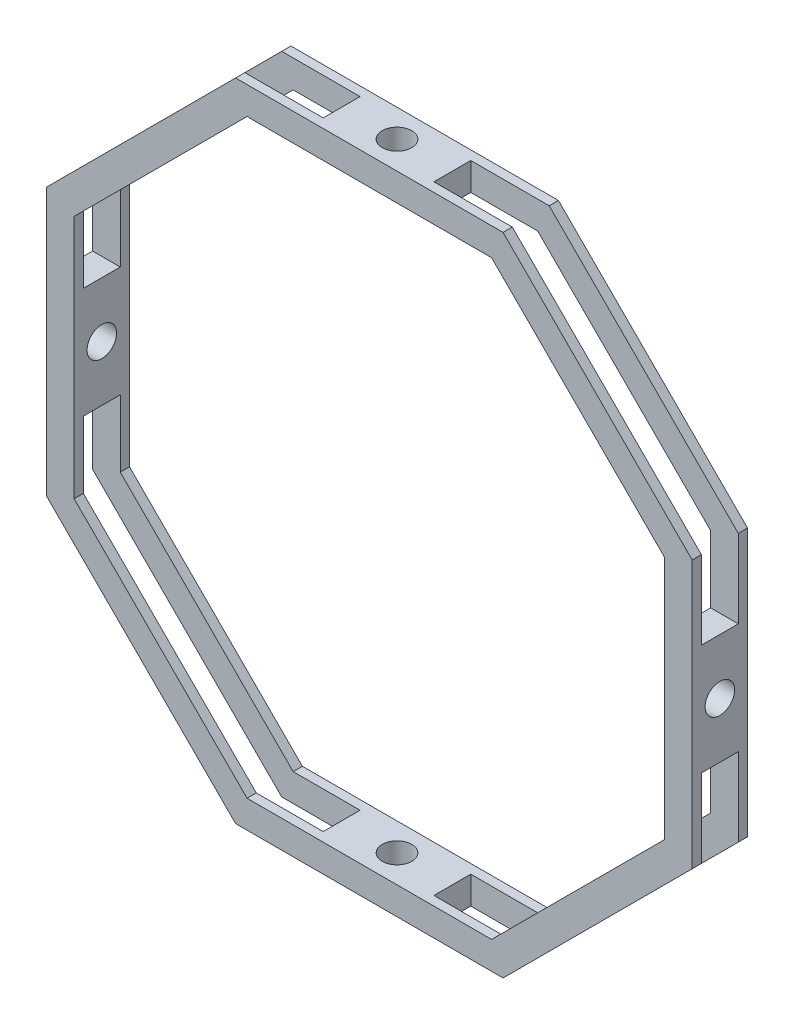
from build123d import *

# Parameters (mm, degrees)
RESSALTO_EXTRUS_O1_DEPTH   = 30
CORTE_EXTRUS_O2_DEPTH      = 393.460189064
CORTE_EXTRUS_O2_DEPTH_BACK = 393.460189064
ESBO_O2_W                  = 20
ESBO_O2_H                  = 42.487373415
CORTE_EXTRUS_O3_DEPTH      = 393.460189064
CORTE_EXTRUS_O3_DEPTH_BACK = 393.460189064
ESBO_O4_R                  = 8
CORTE_EXTRUS_O4_DEPTH      = 393.460189064
CORTE_EXTRUS_O4_DEPTH_BACK = 393.460189064
ESBO_O2_4_W                = 20
ESBO_O2_4_H                = 42.487373415
CORTE_EXTRUS_O5_DEPTH      = 424.551154756
CORTE_EXTRUS_O5_DEPTH_BACK = 424.551154756
ESBO_O15_W                 = 20
ESBO_O15_H                 = 144.97474683
CORTE_EXTRUS_O6_DEPTH      = 424.551154756
CORTE_EXTRUS_O6_DEPTH_BACK = 424.551154756
ESBO_O16_W                 = 20
ESBO_O16_H                 = 144.97474683
CORTE_EXTRUS_O8_DEPTH      = 393.460189064
CORTE_EXTRUS_O8_DEPTH_BACK = 393.460189064
ESBO_O22_W                 = 42.487373415
ESBO_O22_H                 = 20
CORTE_EXTRUS_O9_DEPTH      = 393.460189064
CORTE_EXTRUS_O9_DEPTH_BACK = 393.460189064
ESBO_O23_R                 = 8


with BuildPart() as part:
    # Esboço1 → Ressalto-extrusão1 (new body)
    with BuildSketch(Plane.XY):
        Polygon((175, 72.487373415), (72.487373415, 175), (-72.487373415, 175), (-175, 72.487373415), (-175, -72.487373415), (-72.487373415, -175), (72.487373415, -175), (175, -72.487373415), align=None)
        Polygon((160, 66.27416998), (66.27416998, 160), (-66.27416998, 160), (-160, 66.27416998), (-160, -66.27416998), (-66.27416998, -160), (66.27416998, -160), (160, -66.27416998), align=None, mode=Mode.SUBTRACT)
    extrude(amount=RESSALTO_EXTRUS_O1_DEPTH)

    # Esboço2 → Corte-extrusão2 (cut, two sides: drawn at the far end of the back side and taken through both)
    with BuildSketch(Plane(origin=(175, 0, 0), x_dir=(0, 0, -1), z_dir=(1, 0, 0)).offset(-CORTE_EXTRUS_O2_DEPTH_BACK)):
        with Locations((-15, 51.243686708)):
            Rectangle(ESBO_O2_W, ESBO_O2_H)
    extrude(amount=CORTE_EXTRUS_O2_DEPTH + CORTE_EXTRUS_O2_DEPTH_BACK, mode=Mode.SUBTRACT)

    # Esboço4 → Corte-extrusão3 (cut, two sides: drawn at the far end of the back side and taken through both)
    with BuildSketch(Plane(origin=(175, 0, 0), x_dir=(0, 0, -1), z_dir=(1, 0, 0)).offset(-CORTE_EXTRUS_O3_DEPTH_BACK)):
        with Locations((-15, 0)):
            Circle(ESBO_O4_R)
    extrude(amount=CORTE_EXTRUS_O3_DEPTH + CORTE_EXTRUS_O3_DEPTH_BACK, mode=Mode.SUBTRACT)

    # Esboço2<4> → Corte-extrusão4 (cut, two sides: drawn at the far end of the back side and taken through both)
    with BuildSketch(Plane(origin=(175, 0, 0), x_dir=(0, 0, -1), z_dir=(1, 0, 0)).offset(-CORTE_EXTRUS_O4_DEPTH_BACK)):
        with Locations((-15, -51.243686708)):
            Rectangle(ESBO_O2_4_W, ESBO_O2_4_H)
    extrude(amount=CORTE_EXTRUS_O4_DEPTH + CORTE_EXTRUS_O4_DEPTH_BACK, mode=Mode.SUBTRACT)

    # Esboço15 → Corte-extrusão5 (cut, two sides: drawn at the far end of the back side and taken through both)
    with BuildSketch(Plane(origin=(-123.743686708, 123.743686708, 0), x_dir=(0, 0, 1), z_dir=(-0.7071067811865486, 0.7071067811865465, 0)).offset(-CORTE_EXTRUS_O5_DEPTH_BACK)):
        with Locations((15, 0)):
            Rectangle(ESBO_O15_W, ESBO_O15_H)
    extrude(amount=CORTE_EXTRUS_O5_DEPTH + CORTE_EXTRUS_O5_DEPTH_BACK, mode=Mode.SUBTRACT)

    # Esboço16 → Corte-extrusão6 (cut, two sides: drawn at the far end of the back side and taken through both)
    with BuildSketch(Plane(origin=(123.743686708, 123.743686708, 0), x_dir=(0, 0, -1), z_dir=(0.7071067811865465, 0.7071067811865487, 0)).offset(-CORTE_EXTRUS_O6_DEPTH_BACK)):
        with Locations((-15, 0)):
            Rectangle(ESBO_O16_W, ESBO_O16_H)
    extrude(amount=CORTE_EXTRUS_O6_DEPTH + CORTE_EXTRUS_O6_DEPTH_BACK, mode=Mode.SUBTRACT)

    # Esboço22 → Corte-extrusão8 (cut, two sides: drawn at the far end of the back side and taken through both)
    with BuildSketch(Plane(origin=(0, 175, 0), x_dir=(1, 0, 0), z_dir=(0, 1, 0)).offset(-CORTE_EXTRUS_O8_DEPTH_BACK)):
        with Locations((-51.243686708, -15)):
            Rectangle(ESBO_O22_W, ESBO_O22_H)
        with Locations((51.243686708, -15)):
            Rectangle(ESBO_O22_W, ESBO_O22_H)
    extrude(amount=CORTE_EXTRUS_O8_DEPTH + CORTE_EXTRUS_O8_DEPTH_BACK, mode=Mode.SUBTRACT)

    # Esboço23 → Corte-extrusão9 (cut, two sides: drawn at the far end of the back side and taken through both)
    with BuildSketch(Plane(origin=(0, 175, 0), x_dir=(1, 0, 0), z_dir=(0, 1, 0)).offset(-CORTE_EXTRUS_O9_DEPTH_BACK)):
        with Locations((0, -15)):
            Circle(ESBO_O23_R)
    extrude(amount=CORTE_EXTRUS_O9_DEPTH + CORTE_EXTRUS_O9_DEPTH_BACK, mode=Mode.SUBTRACT)


solid = part.part
